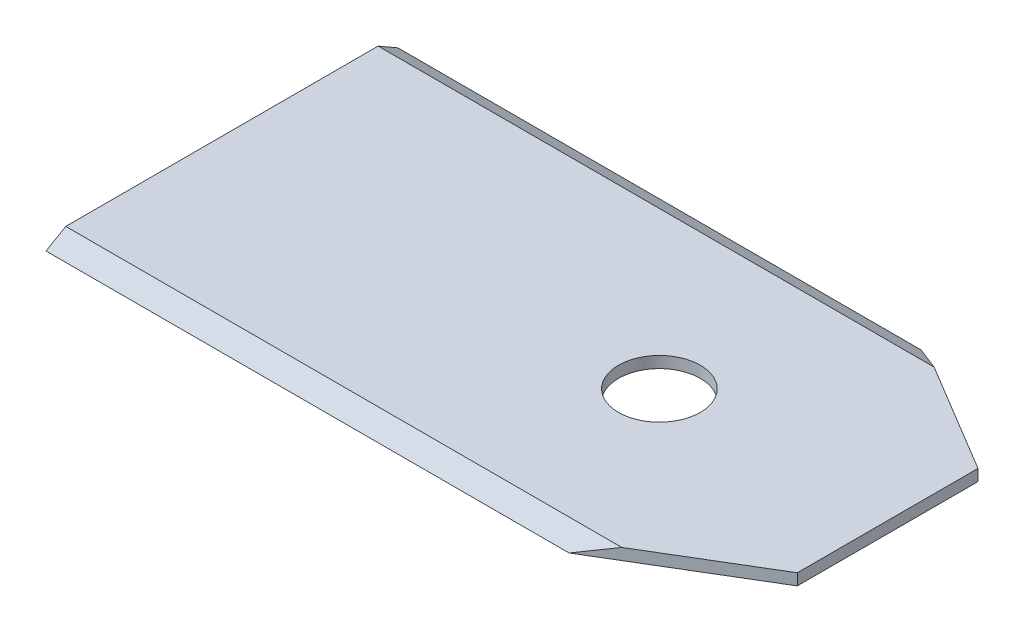
from build123d import *
from OCP.BRepFilletAPI import BRepFilletAPI_MakeChamfer

# Parameters (mm, degrees)
BOSS_EXTRU_1_DEPTH = 0.6
D_GAGEMENT_M41_D   = 4.3
CHANFREIN1_SIZE    = 0.6
CHANFREIN1_SIZE_2  = 1.039230485


with BuildPart() as part:
    # Esquisse1 → Boss.-Extru.1 (new body)
    with BuildSketch(Plane(origin=(0, 0, 0), x_dir=(1, 0, 0), z_dir=(0, 1, 0))):
        Polygon((27.5, 9.25), (35, 4.75), (35, -4.75), (27.5, -9.25), (0, -9.25), (0, 9.25), align=None)
    extrude(amount=BOSS_EXTRU_1_DEPTH)

    # Dégagement M41 (through all)
    with Locations(Plane(origin=(0, 0.6, 0), x_dir=(1, 0, 0), z_dir=(0, 1, 0))):
        with Locations((23, 0)):
            Hole(D_GAGEMENT_M41_D / 2)

    # Chanfrein1
    chanfrein1_edges_1 = [part.edges().sort_by_distance(p)[0] for p in [
        (13.75, 0.6, -9.25),
    ]]
    chanfrein1_side_1 = [part.faces().sort_by_distance(p)[0] for p in [
        (13.75, 0.588, -9.25),
    ]]
    chanfrein1_edges_2 = [part.edges().sort_by_distance(p)[0] for p in [
        (13.75, 0.6, 9.25),
    ]]
    chanfrein1_side_2 = [part.faces().sort_by_distance(p)[0] for p in [
        (13.75, 0.6, 9.238),
    ]]
    chanfrein1 = BRepFilletAPI_MakeChamfer(part.part.solid().wrapped)
    for e in chanfrein1_edges_1:
        chanfrein1.Add(CHANFREIN1_SIZE - 0.0001, CHANFREIN1_SIZE_2 - 0.0001, e.wrapped, chanfrein1_side_1[0].wrapped)
    for e in chanfrein1_edges_2:
        chanfrein1.Add(CHANFREIN1_SIZE_2 - 0.0001, CHANFREIN1_SIZE - 0.0001, e.wrapped, chanfrein1_side_2[0].wrapped)
    add(Compound.cast(chanfrein1.Shape()), mode=Mode.REPLACE)  # a hair under: the kernel refuses the full size


solid = part.part
